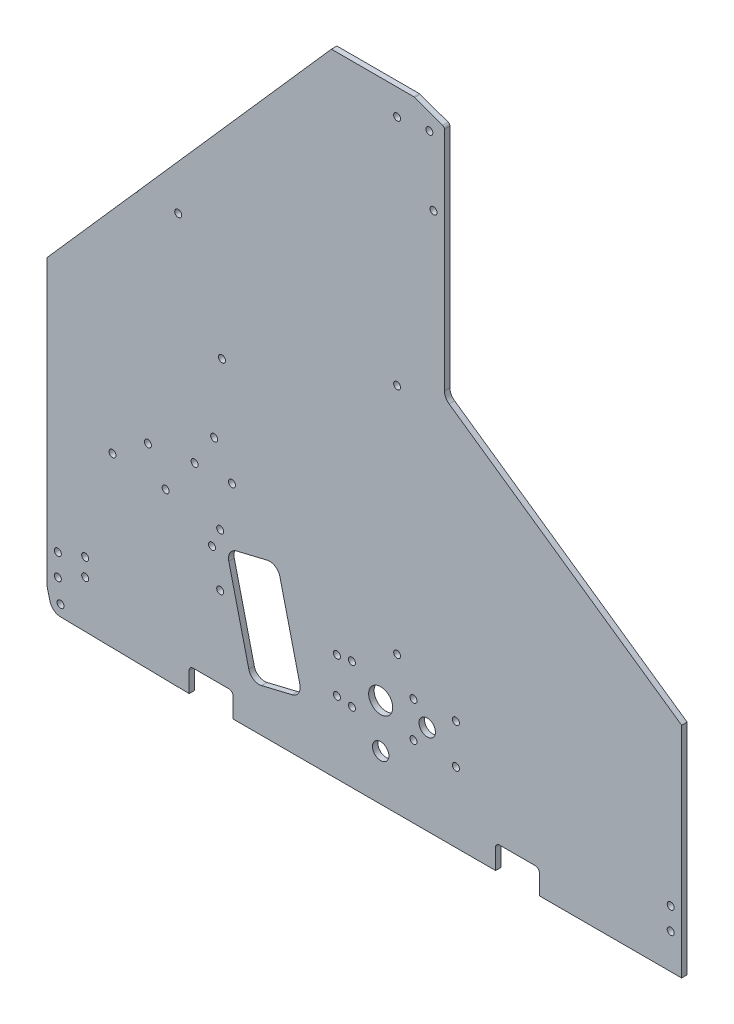
from build123d import *

# Parameters (mm, degrees)
SKETCH1_R           = 2.032
SKETCH1_R_2         = 2
BOSS_EXTRUDE1_DEPTH = 3.175
FILLET1_R           = 2.286
FILLET2_R           = 6.35
SKETCH2_R           = 2.032
CUT_EXTRUDE1_DEPTH  = 505.524983177
FILLET3_R           = 1.5875
CUT_EXTRUDE2_DEPTH  = 505.524983177
SKETCH4_R           = 2.032
SKETCH4_R_2         = 6.985
SKETCH4_R_3         = 4.7625
CUT_EXTRUDE3_DEPTH  = 505.524983177


with BuildPart() as part:
    # Sketch1 → Boss-Extrude1 (new body)
    with BuildSketch(Plane.XY):
        with BuildLine():
            Line((7.829508682, -19.049081656), (82.55, -20.32))
            Line((82.55, -20.32), (82.55, -6.35))
            Line((82.55, -6.35), (107.95, -6.35))
            Line((107.95, -6.35), (107.95, -20.32))
            Line((107.95, -20.32), (260.35, -20.32))
            Line((260.35, -20.32), (260.35, -6.35))
            Line((260.35, -6.35), (285.75, -6.35))
            Line((285.75, -6.35), (285.75, -20.32))
            Line((285.75, -20.32), (368.3, -20.32))
            Line((368.3, -20.32), (368.3, 106.68))
            Line((368.3, 106.68), (230.66375, 202.565))
            Line((230.66375, 202.565), (230.66375, 338.455))
            Line((230.66375, 338.455), (213.19998, 344.805))
            Line((213.19998, 344.805), (203.2, 344.805))
            Line((203.2, 344.805), (165.1, 344.805))
            Line((165.1, 344.805), (52.785053316, 217.37073357))
            ThreePointArc((52.785053316, 217.37073357), (52.324424301, 216.461439599), (51.480201332, 215.890228435))
            Line((51.480201332, 215.890228435), (0, 157.48))
            Line((0, 157.48), (0, 0))
            Line((0, 0), (0, -6.35))
            ThreePointArc((0, -6.35), (0.047577015, -7.125863724), (0.189595124, -7.890101219))
            Line((0.189595124, -7.890101219), (1.777095124, -14.240101219))
            ThreePointArc((1.777095124, -14.240101219), (3.987212552, -17.671692778), (7.829508682, -19.049081656))
        make_face()
        with Locations((7.9375, -12.7)):
            Circle(SKETCH1_R, mode=Mode.SUBTRACT)
        with Locations((6.35, 0)):
            Circle(SKETCH1_R, mode=Mode.SUBTRACT)
        with Locations((6.35, 12.7)):
            Circle(SKETCH1_R, mode=Mode.SUBTRACT)
        with Locations((95.797306087, 60.410494967)):
            Circle(SKETCH1_R, mode=Mode.SUBTRACT)
        with Locations((38.1, 78.105)):
            Circle(SKETCH1_R, mode=Mode.SUBTRACT)
        with Locations((68.887329744, 75.518700365)):
            Circle(SKETCH1_R, mode=Mode.SUBTRACT)
        with Locations((58.568579744, 93.391299635)):
            Circle(SKETCH1_R, mode=Mode.SUBTRACT)
        with Locations((85.725, 97.155)):
            Circle(SKETCH1_R, mode=Mode.SUBTRACT)
        with Locations((107.382158942, 97.743700365)):
            Circle(SKETCH1_R, mode=Mode.SUBTRACT)
        with Locations((97.063408942, 115.616299635)):
            Circle(SKETCH1_R, mode=Mode.SUBTRACT)
        with Locations((101.6, 157.48)):
            Circle(SKETCH1_R, mode=Mode.SUBTRACT)
        with Locations((203.2, 59.805)):
            Circle(SKETCH1_R_2, mode=Mode.SUBTRACT)
        with Locations((361.95, 0)):
            Circle(SKETCH1_R, mode=Mode.SUBTRACT)
        with Locations((361.95, 12.7)):
            Circle(SKETCH1_R, mode=Mode.SUBTRACT)
        with Locations((76.2, 217.805)):
            Circle(SKETCH1_R, mode=Mode.SUBTRACT)
        with Locations((203.2, 194.805)):
            Circle(SKETCH1_R_2, mode=Mode.SUBTRACT)
        with Locations((224.31375, 293.243)):
            Circle(SKETCH1_R, mode=Mode.SUBTRACT)
        with Locations((203.2, 329.805)):
            Circle(SKETCH1_R_2, mode=Mode.SUBTRACT)
        with Locations((221.931865, 332.105)):
            Circle(SKETCH1_R_2, mode=Mode.SUBTRACT)
    extrude(amount=BOSS_EXTRUDE1_DEPTH)

    # Fillet1
    fillet1_edges = [part.edges().sort_by_distance(p)[0] for p in [
        (285.75, -6.35, 1.5875),
        (107.95, -6.35, 1.5875),
        (260.35, -6.35, 1.5875),
        (82.55, -6.35, 1.5875),
    ]]
    fillet(fillet1_edges, radius=FILLET1_R)

    # Fillet2
    fillet2_edges = [part.edges().sort_by_distance(p)[0] for p in [
        (230.66375, 202.565, 1.5875),
    ]]
    fillet(fillet2_edges, radius=FILLET2_R)

    # Sketch2 → Cut-Extrude1 (cut, through all)
    with BuildSketch(Plane(origin=(0, 0, 0), x_dir=(-1, 0, 0), z_dir=(0, 0, -1))):
        with Locations((-100.552770272, 71.086035298)):
            Circle(SKETCH2_R)
        with Locations((-100.552770272, 40.606035298)):
            Circle(SKETCH2_R)
        with Locations((-22.225, 18.202541089)):
            Circle(SKETCH2_R)
        with Locations((-22.225, 8.042541089)):
            Circle(SKETCH2_R)
    extrude(amount=-CUT_EXTRUDE1_DEPTH, mode=Mode.SUBTRACT)

    # Fillet3
    fillet3_edges = [part.edges().sort_by_distance(p)[0] for p in [
        (230.66375, 338.455, 1.5875),
        (213.19998, 344.805, 1.5875),
    ]]
    fillet(fillet3_edges, radius=FILLET3_R)

    # Sketch3 → Cut-Extrude2 (cut, through all)
    with BuildSketch(Plane.XY.offset(3.175)):
        with BuildLine():
            Line((127.789350211, 69.359774106), (110.090750339, 65.117184968))
            ThreePointArc((110.090750339, 65.117184968), (106.287939856, 62.356288953), (105.55119507, 57.715047577))
            Line((105.55119507, 57.715047577), (117.160037875, 9.287010566))
            ThreePointArc((117.160037875, 9.287010566), (119.92093389, 5.484200083), (124.562175266, 4.747455297))
            Line((124.562175266, 4.747455297), (142.260775137, 8.990044434))
            ThreePointArc((142.260775137, 8.990044434), (146.063585621, 11.75094045), (146.800330407, 16.392181825))
            Line((146.800330407, 16.392181825), (135.191487602, 64.820218836))
            ThreePointArc((135.191487602, 64.820218836), (132.430591586, 68.62302932), (127.789350211, 69.359774106))
        make_face()
    extrude(amount=-CUT_EXTRUDE2_DEPTH, mode=Mode.SUBTRACT)

    # Sketch4 → Cut-Extrude3 (cut, through all)
    with BuildSketch(Plane.XY.offset(3.175)):
        with Locations((168.275, 42.06875)):
            Circle(SKETCH4_R)
        with Locations((212.725, 42.06875)):
            Circle(SKETCH4_R)
        with Locations((212.725, 21.43125)):
            Circle(SKETCH4_R)
        with Locations((168.275, 21.43125)):
            Circle(SKETCH4_R)
        with Locations((193.675, 31.75)):
            Circle(SKETCH4_R_2)
        with Locations((220.6625, 31.75)):
            Circle(SKETCH4_R_3)
        with Locations((177.00498, 43.2181)):
            Circle(SKETCH4_R)
        with Locations((177.00498, 20.2819)):
            Circle(SKETCH4_R)
        with Locations((237.32998, 43.2181)):
            Circle(SKETCH4_R)
        with Locations((237.32998, 20.2819)):
            Circle(SKETCH4_R)
        with Locations((193.675, 6.35)):
            Circle(SKETCH4_R_3)
    extrude(amount=-CUT_EXTRUDE3_DEPTH, mode=Mode.SUBTRACT)


solid = part.part
